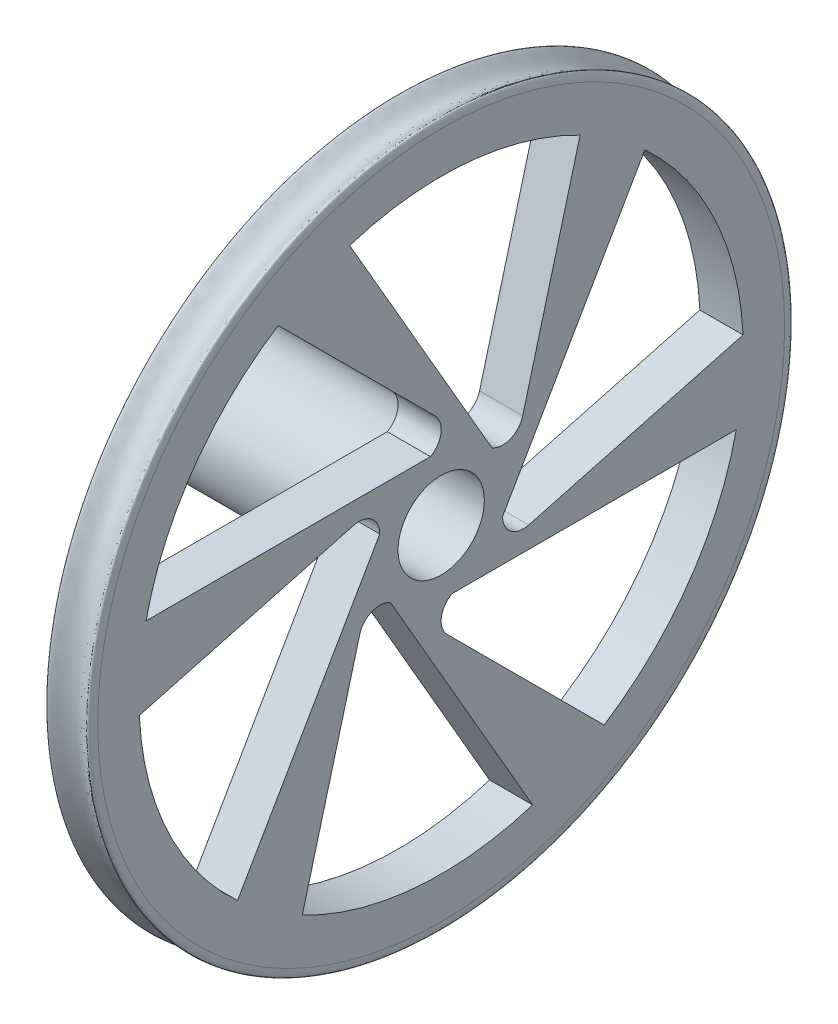
from build123d import *

# Parameters (mm, degrees)
SKETCH2_R           = 4.7625
BOSS_EXTRUDE1_DEPTH = 12.7
CUT_EXTRUDE1_DEPTH  = 40.970251034
CIRPATTERN1_COUNT   = 6
FILLET1_DEPTH       = 3.175
CHAMFER1_SIZE       = 0.254
SKETCH4_R           = 3.175
CUT_EXTRUDE2_DEPTH  = 4.7625


with BuildPart() as part:
    # Sketch1 → Revolve1 (revolve)
    with BuildSketch(Plane(origin=(0, 0, 0), x_dir=(1, 0, 0), z_dir=(0, 1, 0))):
        with BuildLine():
            Line((0, 0), (3.175, 0))
            Line((3.175, 0), (3.175, 25.263345398))
            add(Edge.make_bspline(
                [(0, 25.4), (0, 27.803345398), (1.5875, 21.453345398), (3.175, 27.803345398), (3.175, 25.263345398)],
                knots=[0, 0, 0, 0, 0, 1, 1, 1, 1, 1], degree=4))
            Line((0, 25.4), (0, 0))
        make_face()
    revolve(axis=Axis((0, 0, 0), (1, 0, 0)))

    # Sketch2 → Boss-Extrude1 (add)
    with BuildSketch(Plane.ZY):
        with Locations(Location((0, 0, 0), (0, 0, 180))):
            Circle(SKETCH2_R)
        with BuildLine():
            Line((1.132738197, -2.273434446), (2.250324949, 1.177980315))
            ThreePointArc((2.250324949, 1.177980315), (0.782467236, 2.416473676), (-1.132738197, 2.273434446))
            Line((-1.132738197, 2.273434446), (-2.250324949, -1.177980315))
            ThreePointArc((-2.250324949, -1.177980315), (-0.782467236, -2.416473676), (1.132738197, -2.273434446))
        make_face(mode=Mode.SUBTRACT)
    extrude(amount=BOSS_EXTRUDE1_DEPTH)

    # Sketch3 → Cut-Extrude1 (cut, through all)
    with BuildSketch(Plane(origin=(3.175, 0, 0), x_dir=(0, 0, -1), z_dir=(1, 0, 0))):
        with BuildLine():
            Line((-21.708736001, 4.7625), (0, 4.7625))
            ThreePointArc((0, 4.7625), (1.822529847, 4.399976274), (3.367596045, 3.367596045))
            Line((3.367596045, 3.367596045), (-11.982798392, 18.717990483))
            ThreePointArc((-11.982798392, 18.717990483), (-18.233727021, 12.707549879), (-21.708736001, 4.7625))
        make_face()
    cut_extrude1 = extrude(amount=-CUT_EXTRUDE1_DEPTH, mode=Mode.SUBTRACT)

    # CirPattern1: Cut-Extrude1 ×6 about axis
    cirpattern1_axis = Axis((0, 0, 0), (1, 0, 0))
    for i in range(1, CIRPATTERN1_COUNT):
        add(cut_extrude1.rotate(cirpattern1_axis, i * 360 / CIRPATTERN1_COUNT), mode=Mode.SUBTRACT)

    # Fillet1: read off the stored shape, not the designer's step
    # Fillet1 outline → Fillet1 (add)
    with BuildSketch(Plane.YZ):
        with BuildLine():
            ThreePointArc((-3.971931086, 5.994778536), (-2.951584128, 5.089234917), (-3.064928685, 3.729723913))
            Line((-3.064928685, 3.729723913), (-2.38125, 4.124445986))
            ThreePointArc((-2.38125, 4.124445986), (-0.621630991, 4.721756152), (1.232625702, 4.600221748))
            Line((1.232625702, 4.600221748), (-3.971931086, 5.994778536))
        make_face()
        with BuildLine():
            ThreePointArc((-4.7625, 0), (-4.399976274, 1.822529847), (-3.367596045, 3.367596045))
            Line((-3.367596045, 3.367596045), (-7.177596045, -0.442403955))
            ThreePointArc((-7.177596045, -0.442403955), (-5.883198788, -0.011529378), (-4.7625, -0.789444146))
            Line((-4.7625, -0.789444146), (-4.7625, 0))
        make_face()
        with BuildLine():
            Line((1.697571315, 4.519168058), (2.38125, 4.124445986))
            ThreePointArc((2.38125, 4.124445986), (3.778345283, 2.899226306), (4.600221748, 1.232625702))
            Line((4.600221748, 1.232625702), (3.205664959, 6.437182491))
            ThreePointArc((3.205664959, 6.437182491), (2.93161466, 5.100764295), (1.697571315, 4.519168058))
        make_face()
        with BuildLine():
            ThreePointArc((-2.38125, -4.124445986), (-3.778345283, -2.899226306), (-4.600221748, -1.232625702))
            Line((-4.600221748, -1.232625702), (-3.205664959, -6.437182491))
            ThreePointArc((-3.205664959, -6.437182491), (-2.93161466, -5.100764295), (-1.697571315, -4.519168058))
            Line((-1.697571315, -4.519168058), (-2.38125, -4.124445986))
        make_face()
        with BuildLine():
            Line((4.7625, 0.789444146), (4.7625, 0))
            ThreePointArc((4.7625, 0), (4.399976274, -1.822529847), (3.367596045, -3.367596045))
            Line((3.367596045, -3.367596045), (7.177596045, 0.442403955))
            ThreePointArc((7.177596045, 0.442403955), (5.883198788, 0.011529378), (4.7625, 0.789444146))
        make_face()
        with BuildLine():
            ThreePointArc((2.38125, -4.124445986), (0.621630991, -4.721756152), (-1.232625702, -4.600221748))
            Line((-1.232625702, -4.600221748), (3.971931086, -5.994778536))
            ThreePointArc((3.971931086, -5.994778536), (2.951584128, -5.089234917), (3.064928685, -3.729723913))
            Line((3.064928685, -3.729723913), (2.38125, -4.124445986))
        make_face()
    extrude(amount=FILLET1_DEPTH)

    # Chamfer1
    chamfer1_edges = [part.edges().sort_by_distance(p)[0] for p in [
        (-12.7, 0, 4.7625),
    ]]
    chamfer(chamfer1_edges, length=CHAMFER1_SIZE)

    # Sketch4 → Cut-Extrude2 (cut)
    with BuildSketch(Plane(origin=(3.175, 0, 0), x_dir=(0, 0, -1), z_dir=(1, 0, 0))):
        Circle(SKETCH4_R)
    extrude(amount=-CUT_EXTRUDE2_DEPTH, mode=Mode.SUBTRACT)


solid = part.part
